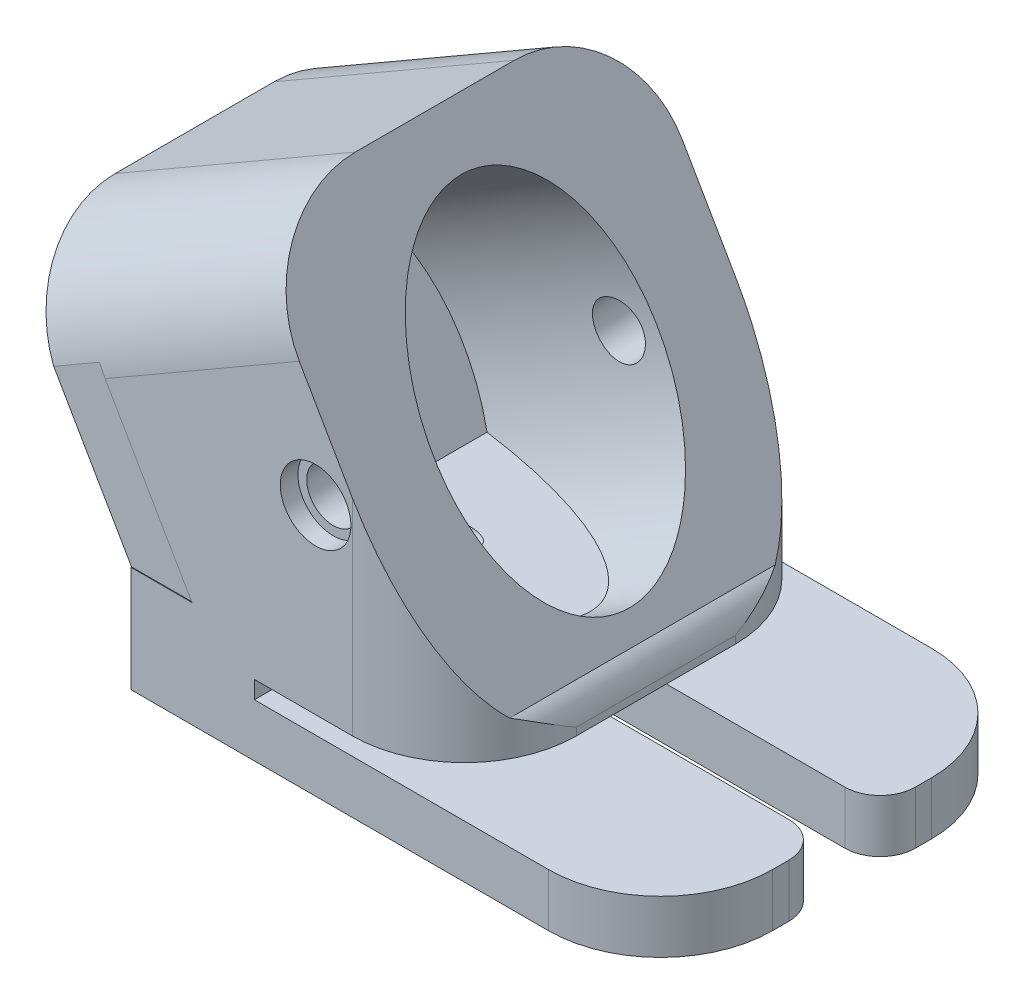
from build123d import *

# Parameters (mm, degrees)
SKETCH2_W           = 21.7
SKETCH2_H           = 25.05
SKETCH2_RX          = 9.525
SKETCH2_RY          = 6.35
BOSS_EXTRUDE1_DEPTH = 12.7
SKETCH3_W           = 21.660653916
SKETCH3_H           = 25.05
BOSS_EXTRUDE2_DEPTH = 3
SKETCH5_W           = 18.892037138
SKETCH5_H           = 21.7
BOSS_EXTRUDE3_DEPTH = 2
SKETCH6_W           = 30
SKETCH6_H           = 21.7
BOSS_EXTRUDE4_DEPTH = 4
SKETCH7_W           = 21.7
SKETCH7_H           = 1
SKETCH7_W_2         = 3.175
SKETCH7_H_2         = 3
CUT_EXTRUDE2_DEPTH  = 23
SKETCH7_3_W         = 21.7
SKETCH7_3_H         = 7.272473706
CUT_EXTRUDE3_DEPTH  = 44.803879418
CUT_REVOLVE1_START  = -0.75
CUT_REVOLVE1_DEPTH  = 1.5
FILLET1_R           = 0.6
CUT_EXTRUDE4_REACH  = 47.088
SKETCH9_R           = 1.5
SKETCH10_R          = 2
CUT_EXTRUDE7_DEPTH  = 1
FILLET5_R           = 6.35
FILLET6_R           = 2
FILLET7_R           = 2


# Read off the part's stored shape, not the designer's step: Cut-Revolve1
with BuildPart() as part:
    # Sketch2 → Boss-Extrude1 (new body)
    with BuildSketch(Plane(origin=(16.497783942, 9.525, 0), x_dir=(0, 0, -1), z_dir=(0.8660254037844379, 0.5000000000000013, 0))):
        Rectangle(SKETCH2_W, SKETCH2_H)
        with Locations(Location((0, 0), (0, 0, 90))):
            Ellipse(SKETCH2_RX, SKETCH2_RY, mode=Mode.SUBTRACT)
    extrude(amount=-BOSS_EXTRUDE1_DEPTH)

    # Sketch3 → Boss-Extrude2 (add)
    with BuildSketch(Plane(origin=(5.499261314, 3.175, 0), x_dir=(0, 0, 1), z_dir=(-0.8660254037844379, -0.5000000000000014, 0))):
        with Locations((-0.019673042, 0)):
            Rectangle(SKETCH3_W, SKETCH3_H)
    extrude(amount=BOSS_EXTRUDE2_DEPTH)

    # Sketch5 → Boss-Extrude3 (add)
    with BuildSketch(Plane(origin=(0, 0, 0), x_dir=(-1, 0, 0), z_dir=(0, 1, 0))):
        with Locations((-13.314265373, 0)):
            Rectangle(SKETCH5_W, SKETCH5_H)
    extrude(amount=-BOSS_EXTRUDE3_DEPTH)

    # Sketch6 → Boss-Extrude4 (add)
    with BuildSketch(Plane.XZ.offset(2)):
        with Locations((18.868246804, 0)):
            Rectangle(SKETCH6_W, SKETCH6_H)
    extrude(amount=BOSS_EXTRUDE4_DEPTH)

    # Sketch7 → Cut-Extrude2 (cut)
    with BuildSketch(Plane(origin=(33.868246804, 0, 0), x_dir=(0, 0, -1), z_dir=(1, 0, 0))):
        with Locations((0, -2.5)):
            Rectangle(SKETCH7_W, SKETCH7_H)
        with Locations((0, -4.5)):
            Rectangle(SKETCH7_W_2, SKETCH7_H_2)
    extrude(amount=-CUT_EXTRUDE2_DEPTH, mode=Mode.SUBTRACT)

    # Sketch7<3> → Cut-Extrude3 (cut, through all)
    with BuildSketch(Plane(origin=(33.868246804, 0, 0), x_dir=(0, 0, -1), z_dir=(1, 0, 0))):
        with Locations((0, -9.636236853)):
            Rectangle(SKETCH7_3_W, SKETCH7_3_H)
    extrude(amount=-CUT_EXTRUDE3_DEPTH, mode=Mode.SUBTRACT)

    # Cut-Revolve1 outline → Cut-Revolve1 (cut)
    with BuildSketch(Plane.XY.offset(CUT_REVOLVE1_START)):
        Polygon((6.841174209, 0.850738686), (3.377072594, 0.850738686), (3.868246804, 0), (3.868246804, -5.099015085), (12.7, 0), (7.332348419, 0), align=None)
    extrude(amount=CUT_REVOLVE1_DEPTH, mode=Mode.SUBTRACT)

    # Fillet1
    fillet1_edges = [part.edges().sort_by_distance(p)[0] for p in [
        (5.109123401, 0.850738686, 0.75),
        (5.109123401, 0.850738686, -0.75),
        (8.284123402, -2.549507542, -0.75),
        (8.284123402, -2.549507542, 0.75),
    ]]
    fillet(fillet1_edges, radius=FILLET1_R)

    # Sketch9 → Cut-Extrude4 (cut, up to next)
    with BuildSketch(Plane(origin=(0, 0, -10.85), x_dir=(-1, 0, 0), z_dir=(0, 0, -1)), mode=Mode.PRIVATE) as cut_extrude4_sk1:
        with Locations((-14.332720433, 8.275)):
            Circle(SKETCH9_R)
    cut_extrude4_tool1 = extrude(cut_extrude4_sk1.sketch, amount=-CUT_EXTRUDE4_REACH, mode=Mode.PRIVATE) & part.part
    cut_extrude4 = cut_extrude4_tool1.solids().sort_by_distance((14.33272, 8.275, -10.85))[0]
    add(cut_extrude4, mode=Mode.SUBTRACT)

    # Sketch10 → Cut-Extrude7 (cut)
    with BuildSketch(Plane(origin=(0, 0, -10.85), x_dir=(-1, 0, 0), z_dir=(0, 0, -1))):
        with Locations((-14.332720433, 8.275)):
            Circle(SKETCH10_R)
    cut_extrude7 = extrude(amount=-CUT_EXTRUDE7_DEPTH, mode=Mode.SUBTRACT)

    # Mirror1: Cut-Extrude4, Cut-Extrude7 across plane
    add(cut_extrude4.mirror(Plane.XY), mode=Mode.SUBTRACT)
    add(cut_extrude7.mirror(Plane.XY), mode=Mode.SUBTRACT)

    # Fillet5
    fillet5_edges = [part.edges().sort_by_distance(p)[0] for p in [
        (33.868246804, -4.5, 10.85),
        (33.868246804, -4.5, -10.85),
        (22.760283942, -1, -10.85),
        (22.760283942, -1, 10.85),
        (4.736022628, 17.196968182, 10.85),
        (3.436984522, 16.446968182, -10.85),
    ]]
    fillet(fillet5_edges, radius=FILLET5_R)

    # Fillet6
    fillet6_edges = [part.edges().sort_by_distance(p)[0] for p in [
        (33.868246804, -4.5, 1.5875),
        (33.868246804, -4.5, -1.5875),
    ]]
    fillet(fillet6_edges, radius=FILLET6_R)

    # Fillet7
    # the kernel refuses this fillet: 2 mm, written as the material it takes off along each edge
    with BuildSketch(Plane(origin=(22.760283942, 0, 8.429393602), x_dir=(-1, 0, 0), z_dir=(0, 0, -1))) as fillet7_piece_1:
        with BuildLine():
            CenterArc((2, -1.571757441), FILLET7_R, 128.197977663, 51.802022337)
            Line((0, -1.571757441), (-0.04, -1.571757441))
            Line((-0.04, -1.571757441), (-0.04, 0))
            Line((-0.04, 0), (0, 0.04))
            ThreePointArc((0, 0.04), (0.381619343, 0.04), (0.73850346, 0.031435149))
            Line((0.73850346, 0.031435149), (0.763238686, 0))
        make_face()
    extrude(amount=16.858787203, mode=Mode.SUBTRACT)


solid = part.part
